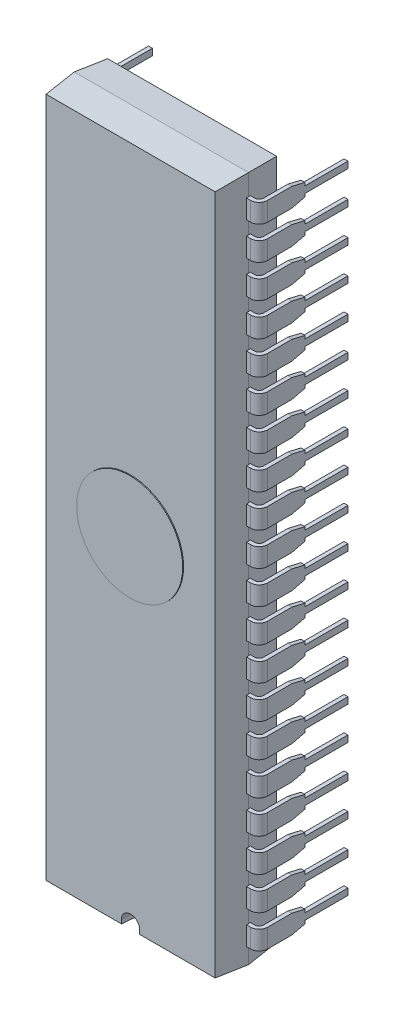
from build123d import *

# Parameters (mm, degrees)
BASIC_SHAPE_DEPTH               = 26.3
SIDE_PROFILE1_DEPTH             = 28.73140458
SIDE_PROFILE1_DEPTH_BACK        = 28.73140458
SIDE_PROFILE2_DEPTH             = 28.73140458
SIDE_PROFILE2_DEPTH_BACK        = 28.73140458
SKETCH6_W                       = 0.3
SKETCH6_H                       = 1.45
PIN_RELIEF_DEPTH                = 31.348853833
REMAINING_PINS_COUNT            = 20
REMAINING_PINS_PITCH            = 2.54
REMAINING_PINS_COPY_1_SKETCH_W  = 0.3
REMAINING_PINS_COPY_1_SKETCH_H  = 1.45
REMAINING_PINS_COPY_2_SKETCH_W  = 0.3
REMAINING_PINS_COPY_2_SKETCH_H  = 1.45
REMAINING_PINS_COPY_3_SKETCH_W  = 0.3
REMAINING_PINS_COPY_3_SKETCH_H  = 1.45
REMAINING_PINS_COPY_4_SKETCH_W  = 0.3
REMAINING_PINS_COPY_4_SKETCH_H  = 1.45
REMAINING_PINS_COPY_5_SKETCH_W  = 0.3
REMAINING_PINS_COPY_5_SKETCH_H  = 1.45
REMAINING_PINS_COPY_6_SKETCH_W  = 0.3
REMAINING_PINS_COPY_6_SKETCH_H  = 1.45
REMAINING_PINS_COPY_7_SKETCH_W  = 0.3
REMAINING_PINS_COPY_7_SKETCH_H  = 1.45
REMAINING_PINS_COPY_8_SKETCH_W  = 0.3
REMAINING_PINS_COPY_8_SKETCH_H  = 1.45
REMAINING_PINS_COPY_9_SKETCH_W  = 0.3
REMAINING_PINS_COPY_9_SKETCH_H  = 1.45
REMAINING_PINS_COPY_10_SKETCH_W = 0.3
REMAINING_PINS_COPY_10_SKETCH_H = 1.45
REMAINING_PINS_COPY_11_SKETCH_W = 0.3
REMAINING_PINS_COPY_11_SKETCH_H = 1.45
REMAINING_PINS_COPY_12_SKETCH_W = 0.3
REMAINING_PINS_COPY_12_SKETCH_H = 1.45
REMAINING_PINS_COPY_13_SKETCH_W = 0.3
REMAINING_PINS_COPY_13_SKETCH_H = 1.45
REMAINING_PINS_COPY_14_SKETCH_W = 0.3
REMAINING_PINS_COPY_14_SKETCH_H = 1.45
REMAINING_PINS_COPY_15_SKETCH_W = 0.3
REMAINING_PINS_COPY_15_SKETCH_H = 1.45
REMAINING_PINS_COPY_16_SKETCH_W = 0.3
REMAINING_PINS_COPY_16_SKETCH_H = 1.45
REMAINING_PINS_COPY_17_SKETCH_W = 0.3
REMAINING_PINS_COPY_17_SKETCH_H = 1.45
REMAINING_PINS_COPY_18_SKETCH_W = 0.3
REMAINING_PINS_COPY_18_SKETCH_H = 1.45
REMAINING_PINS_COPY_19_SKETCH_W = 0.3
REMAINING_PINS_COPY_19_SKETCH_H = 1.45
REMAINING_PINS_COPY_20_DEPTH    = 31.348853833
REMAINING_PINS_COPY_21_DEPTH    = 31.348853833
REMAINING_PINS_COPY_22_DEPTH    = 31.348853833
REMAINING_PINS_COPY_23_DEPTH    = 31.348853833
REMAINING_PINS_COPY_24_DEPTH    = 31.348853833
REMAINING_PINS_COPY_25_DEPTH    = 31.348853833
REMAINING_PINS_COPY_26_DEPTH    = 31.348853833
REMAINING_PINS_COPY_27_DEPTH    = 31.348853833
REMAINING_PINS_COPY_28_DEPTH    = 31.348853833
REMAINING_PINS_COPY_29_DEPTH    = 31.348853833
REMAINING_PINS_COPY_30_DEPTH    = 31.348853833
REMAINING_PINS_COPY_31_DEPTH    = 31.348853833
REMAINING_PINS_COPY_32_DEPTH    = 31.348853833
REMAINING_PINS_COPY_33_DEPTH    = 31.348853833
REMAINING_PINS_COPY_34_DEPTH    = 31.348853833
REMAINING_PINS_COPY_35_DEPTH    = 31.348853833
REMAINING_PINS_COPY_36_DEPTH    = 31.348853833
REMAINING_PINS_COPY_37_DEPTH    = 31.348853833
REMAINING_PINS_COPY_38_DEPTH    = 31.348853833
WINDOW_START                    = 5.72
WINDOW_OUTLINE_R                = 4.064
WINDOW_DEPTH                    = 0.07
LOCATION_MARK_DEPTH             = 29.83514954


# Read off the part's stored shape, not the designer's step: Window
with BuildPart() as part:
    # Sketch1 → Basic Shape (new, symmetric)
    with BuildSketch(Plane(origin=(0, 0, 0), x_dir=(1, 0, 0), z_dir=(0, 1, 0))):
        Polygon((-6.48, -5.72), (-6.68, -3.36), (-6.48, -1), (6.48, -1), (6.68, -3.36), (6.48, -5.72), align=None)
    extrude(amount=BASIC_SHAPE_DEPTH, both=True)

    # Sketch2 → Side Profile1 (cut, two sides: drawn at the far end of the back side and taken through both)
    with BuildSketch(Plane(origin=(0, 0, 0), x_dir=(0, 0, -1), z_dir=(1, 0, 0)).offset(-SIDE_PROFILE1_DEPTH_BACK)):
        Polygon((-1, 26.3), (-1, 26.1), (-3.36, 26.3), align=None)
        Polygon((-1, -26.3), (-3.36, -26.3), (-1, -26.1), align=None)
    extrude(amount=SIDE_PROFILE1_DEPTH + SIDE_PROFILE1_DEPTH_BACK, mode=Mode.SUBTRACT)

    # Sketch3 → Side Profile2 (cut, two sides: drawn at the far end of the back side and taken through both)
    with BuildSketch(Plane(origin=(0, 0, 0), x_dir=(0, 0, -1), z_dir=(1, 0, 0)).offset(-SIDE_PROFILE2_DEPTH_BACK)):
        Polygon((-3.36, 26.3), (-5.72, 26.3), (-5.72, 26.1), align=None)
        Polygon((-3.36, -26.3), (-5.72, -26.3), (-5.72, -26.1), align=None)
    extrude(amount=SIDE_PROFILE2_DEPTH + SIDE_PROFILE2_DEPTH_BACK, mode=Mode.SUBTRACT)

    # First Pin: sweep along a path in Sketch5
    with BuildLine(Plane(origin=(0, -24.3, 0), x_dir=(1, 0, 0), z_dir=(0, 1, 0))) as first_pin_path:
        Line((0, -3.36), (6.993, -3.36))
        ThreePointArc((6.993, -3.36), (7.346553391, -3.213553391), (7.493, -2.86))
        Line((7.493, -2.86), (7.493, 3.3))
    # Sketch6 → First Pin (sweep)
    with BuildSketch(Plane(origin=(0, 0, 0), x_dir=(0, 0, -1), z_dir=(1, 0, 0))):
        with Locations((-3.36, -24.3)):
            Rectangle(SKETCH6_W, SKETCH6_H)
    first_pin = sweep(path=first_pin_path.line)

    # Sketch7 → Pin Relief (cut, through all)
    with BuildSketch(Plane.ZY.offset(-7.343)):
        Polygon((-3.3, -24.55), (0, -24.55), (0, -24.7875), (1, -25.025), (-3.3, -25.025), align=None)
        Polygon((-3.3, -24.05), (0, -24.05), (0, -23.8125), (1, -23.575), (-3.3, -23.575), align=None)
    pin_relief = extrude(amount=-PIN_RELIEF_DEPTH, mode=Mode.SUBTRACT)

    # Opp Pin: First Pin, Pin Relief across plane
    add(first_pin.mirror(Plane(origin=(0, 0, 0), x_dir=(0, 0, 1), z_dir=(1, 0, 0))))
    add(pin_relief.mirror(Plane(origin=(0, 0, 0), x_dir=(0, 0, 1), z_dir=(1, 0, 0))), mode=Mode.SUBTRACT)

    # Remaining Pins: First Pin, Pin Relief ×20
    with Locations(*[(0, i * REMAINING_PINS_PITCH, 0) for i in range(1, REMAINING_PINS_COUNT)]):
        add(first_pin)
        add(pin_relief, mode=Mode.SUBTRACT)

    # Remaining Pins copy 1: sweep along a path in Remaining Pins copy 1 path
    with BuildLine(Plane(origin=(0, -21.76, 0), x_dir=(-1, 0, 0), z_dir=(0, 1, 0))) as remaining_pins_copy_1_path:
        Line((0, 3.36), (6.993, 3.36))
        ThreePointArc((6.993, 3.36), (7.346553391, 3.213553391), (7.493, 2.86))
        Line((7.493, 2.86), (7.493, -3.3))
    # Remaining Pins copy 1 sketch → Remaining Pins copy 1 (sweep)
    with BuildSketch(Plane(origin=(0, 2.54, 0), x_dir=(0, 0, -1), z_dir=(-1, 0, 0))):
        with Locations((-3.36, 24.3)):
            Rectangle(REMAINING_PINS_COPY_1_SKETCH_W, REMAINING_PINS_COPY_1_SKETCH_H)
    sweep(path=remaining_pins_copy_1_path.line)

    # Remaining Pins copy 2: sweep along a path in Remaining Pins copy 2 path
    with BuildLine(Plane(origin=(0, -19.22, 0), x_dir=(-1, 0, 0), z_dir=(0, 1, 0))) as remaining_pins_copy_2_path:
        Line((0, 3.36), (6.993, 3.36))
        ThreePointArc((6.993, 3.36), (7.346553391, 3.213553391), (7.493, 2.86))
        Line((7.493, 2.86), (7.493, -3.3))
    # Remaining Pins copy 2 sketch → Remaining Pins copy 2 (sweep)
    with BuildSketch(Plane(origin=(0, 5.08, 0), x_dir=(0, 0, -1), z_dir=(-1, 0, 0))):
        with Locations((-3.36, 24.3)):
            Rectangle(REMAINING_PINS_COPY_2_SKETCH_W, REMAINING_PINS_COPY_2_SKETCH_H)
    sweep(path=remaining_pins_copy_2_path.line)

    # Remaining Pins copy 3: sweep along a path in Remaining Pins copy 3 path
    with BuildLine(Plane(origin=(0, -16.68, 0), x_dir=(-1, 0, 0), z_dir=(0, 1, 0))) as remaining_pins_copy_3_path:
        Line((0, 3.36), (6.993, 3.36))
        ThreePointArc((6.993, 3.36), (7.346553391, 3.213553391), (7.493, 2.86))
        Line((7.493, 2.86), (7.493, -3.3))
    # Remaining Pins copy 3 sketch → Remaining Pins copy 3 (sweep)
    with BuildSketch(Plane(origin=(0, 7.62, 0), x_dir=(0, 0, -1), z_dir=(-1, 0, 0))):
        with Locations((-3.36, 24.3)):
            Rectangle(REMAINING_PINS_COPY_3_SKETCH_W, REMAINING_PINS_COPY_3_SKETCH_H)
    sweep(path=remaining_pins_copy_3_path.line)

    # Remaining Pins copy 4: sweep along a path in Remaining Pins copy 4 path
    with BuildLine(Plane(origin=(0, -14.14, 0), x_dir=(-1, 0, 0), z_dir=(0, 1, 0))) as remaining_pins_copy_4_path:
        Line((0, 3.36), (6.993, 3.36))
        ThreePointArc((6.993, 3.36), (7.346553391, 3.213553391), (7.493, 2.86))
        Line((7.493, 2.86), (7.493, -3.3))
    # Remaining Pins copy 4 sketch → Remaining Pins copy 4 (sweep)
    with BuildSketch(Plane(origin=(0, 10.16, 0), x_dir=(0, 0, -1), z_dir=(-1, 0, 0))):
        with Locations((-3.36, 24.3)):
            Rectangle(REMAINING_PINS_COPY_4_SKETCH_W, REMAINING_PINS_COPY_4_SKETCH_H)
    sweep(path=remaining_pins_copy_4_path.line)

    # Remaining Pins copy 5: sweep along a path in Remaining Pins copy 5 path
    with BuildLine(Plane(origin=(0, -11.6, 0), x_dir=(-1, 0, 0), z_dir=(0, 1, 0))) as remaining_pins_copy_5_path:
        Line((0, 3.36), (6.993, 3.36))
        ThreePointArc((6.993, 3.36), (7.346553391, 3.213553391), (7.493, 2.86))
        Line((7.493, 2.86), (7.493, -3.3))
    # Remaining Pins copy 5 sketch → Remaining Pins copy 5 (sweep)
    with BuildSketch(Plane(origin=(0, 12.7, 0), x_dir=(0, 0, -1), z_dir=(-1, 0, 0))):
        with Locations((-3.36, 24.3)):
            Rectangle(REMAINING_PINS_COPY_5_SKETCH_W, REMAINING_PINS_COPY_5_SKETCH_H)
    sweep(path=remaining_pins_copy_5_path.line)

    # Remaining Pins copy 6: sweep along a path in Remaining Pins copy 6 path
    with BuildLine(Plane(origin=(0, -9.06, 0), x_dir=(-1, 0, 0), z_dir=(0, 1, 0))) as remaining_pins_copy_6_path:
        Line((0, 3.36), (6.993, 3.36))
        ThreePointArc((6.993, 3.36), (7.346553391, 3.213553391), (7.493, 2.86))
        Line((7.493, 2.86), (7.493, -3.3))
    # Remaining Pins copy 6 sketch → Remaining Pins copy 6 (sweep)
    with BuildSketch(Plane(origin=(0, 15.24, 0), x_dir=(0, 0, -1), z_dir=(-1, 0, 0))):
        with Locations((-3.36, 24.3)):
            Rectangle(REMAINING_PINS_COPY_6_SKETCH_W, REMAINING_PINS_COPY_6_SKETCH_H)
    sweep(path=remaining_pins_copy_6_path.line)

    # Remaining Pins copy 7: sweep along a path in Remaining Pins copy 7 path
    with BuildLine(Plane(origin=(0, -6.52, 0), x_dir=(-1, 0, 0), z_dir=(0, 1, 0))) as remaining_pins_copy_7_path:
        Line((0, 3.36), (6.993, 3.36))
        ThreePointArc((6.993, 3.36), (7.346553391, 3.213553391), (7.493, 2.86))
        Line((7.493, 2.86), (7.493, -3.3))
    # Remaining Pins copy 7 sketch → Remaining Pins copy 7 (sweep)
    with BuildSketch(Plane(origin=(0, 17.78, 0), x_dir=(0, 0, -1), z_dir=(-1, 0, 0))):
        with Locations((-3.36, 24.3)):
            Rectangle(REMAINING_PINS_COPY_7_SKETCH_W, REMAINING_PINS_COPY_7_SKETCH_H)
    sweep(path=remaining_pins_copy_7_path.line)

    # Remaining Pins copy 8: sweep along a path in Remaining Pins copy 8 path
    with BuildLine(Plane(origin=(0, -3.98, 0), x_dir=(-1, 0, 0), z_dir=(0, 1, 0))) as remaining_pins_copy_8_path:
        Line((0, 3.36), (6.993, 3.36))
        ThreePointArc((6.993, 3.36), (7.346553391, 3.213553391), (7.493, 2.86))
        Line((7.493, 2.86), (7.493, -3.3))
    # Remaining Pins copy 8 sketch → Remaining Pins copy 8 (sweep)
    with BuildSketch(Plane(origin=(0, 20.32, 0), x_dir=(0, 0, -1), z_dir=(-1, 0, 0))):
        with Locations((-3.36, 24.3)):
            Rectangle(REMAINING_PINS_COPY_8_SKETCH_W, REMAINING_PINS_COPY_8_SKETCH_H)
    sweep(path=remaining_pins_copy_8_path.line)

    # Remaining Pins copy 9: sweep along a path in Remaining Pins copy 9 path
    with BuildLine(Plane(origin=(0, -1.44, 0), x_dir=(-1, 0, 0), z_dir=(0, 1, 0))) as remaining_pins_copy_9_path:
        Line((0, 3.36), (6.993, 3.36))
        ThreePointArc((6.993, 3.36), (7.346553391, 3.213553391), (7.493, 2.86))
        Line((7.493, 2.86), (7.493, -3.3))
    # Remaining Pins copy 9 sketch → Remaining Pins copy 9 (sweep)
    with BuildSketch(Plane(origin=(0, 22.86, 0), x_dir=(0, 0, -1), z_dir=(-1, 0, 0))):
        with Locations((-3.36, 24.3)):
            Rectangle(REMAINING_PINS_COPY_9_SKETCH_W, REMAINING_PINS_COPY_9_SKETCH_H)
    sweep(path=remaining_pins_copy_9_path.line)

    # Remaining Pins copy 10: sweep along a path in Remaining Pins copy 10 path
    with BuildLine(Plane(origin=(0, 1.1, 0), x_dir=(-1, 0, 0), z_dir=(0, 1, 0))) as remaining_pins_copy_10_path:
        Line((0, 3.36), (6.993, 3.36))
        ThreePointArc((6.993, 3.36), (7.346553391, 3.213553391), (7.493, 2.86))
        Line((7.493, 2.86), (7.493, -3.3))
    # Remaining Pins copy 10 sketch → Remaining Pins copy 10 (sweep)
    with BuildSketch(Plane(origin=(0, 25.4, 0), x_dir=(0, 0, -1), z_dir=(-1, 0, 0))):
        with Locations((-3.36, 24.3)):
            Rectangle(REMAINING_PINS_COPY_10_SKETCH_W, REMAINING_PINS_COPY_10_SKETCH_H)
    sweep(path=remaining_pins_copy_10_path.line)

    # Remaining Pins copy 11: sweep along a path in Remaining Pins copy 11 path
    with BuildLine(Plane(origin=(0, 3.64, 0), x_dir=(-1, 0, 0), z_dir=(0, 1, 0))) as remaining_pins_copy_11_path:
        Line((0, 3.36), (6.993, 3.36))
        ThreePointArc((6.993, 3.36), (7.346553391, 3.213553391), (7.493, 2.86))
        Line((7.493, 2.86), (7.493, -3.3))
    # Remaining Pins copy 11 sketch → Remaining Pins copy 11 (sweep)
    with BuildSketch(Plane(origin=(0, 27.94, 0), x_dir=(0, 0, -1), z_dir=(-1, 0, 0))):
        with Locations((-3.36, 24.3)):
            Rectangle(REMAINING_PINS_COPY_11_SKETCH_W, REMAINING_PINS_COPY_11_SKETCH_H)
    sweep(path=remaining_pins_copy_11_path.line)

    # Remaining Pins copy 12: sweep along a path in Remaining Pins copy 12 path
    with BuildLine(Plane(origin=(0, 6.18, 0), x_dir=(-1, 0, 0), z_dir=(0, 1, 0))) as remaining_pins_copy_12_path:
        Line((0, 3.36), (6.993, 3.36))
        ThreePointArc((6.993, 3.36), (7.346553391, 3.213553391), (7.493, 2.86))
        Line((7.493, 2.86), (7.493, -3.3))
    # Remaining Pins copy 12 sketch → Remaining Pins copy 12 (sweep)
    with BuildSketch(Plane(origin=(0, 30.48, 0), x_dir=(0, 0, -1), z_dir=(-1, 0, 0))):
        with Locations((-3.36, 24.3)):
            Rectangle(REMAINING_PINS_COPY_12_SKETCH_W, REMAINING_PINS_COPY_12_SKETCH_H)
    sweep(path=remaining_pins_copy_12_path.line)

    # Remaining Pins copy 13: sweep along a path in Remaining Pins copy 13 path
    with BuildLine(Plane(origin=(0, 8.72, 0), x_dir=(-1, 0, 0), z_dir=(0, 1, 0))) as remaining_pins_copy_13_path:
        Line((0, 3.36), (6.993, 3.36))
        ThreePointArc((6.993, 3.36), (7.346553391, 3.213553391), (7.493, 2.86))
        Line((7.493, 2.86), (7.493, -3.3))
    # Remaining Pins copy 13 sketch → Remaining Pins copy 13 (sweep)
    with BuildSketch(Plane(origin=(0, 33.02, 0), x_dir=(0, 0, -1), z_dir=(-1, 0, 0))):
        with Locations((-3.36, 24.3)):
            Rectangle(REMAINING_PINS_COPY_13_SKETCH_W, REMAINING_PINS_COPY_13_SKETCH_H)
    sweep(path=remaining_pins_copy_13_path.line)

    # Remaining Pins copy 14: sweep along a path in Remaining Pins copy 14 path
    with BuildLine(Plane(origin=(0, 11.26, 0), x_dir=(-1, 0, 0), z_dir=(0, 1, 0))) as remaining_pins_copy_14_path:
        Line((0, 3.36), (6.993, 3.36))
        ThreePointArc((6.993, 3.36), (7.346553391, 3.213553391), (7.493, 2.86))
        Line((7.493, 2.86), (7.493, -3.3))
    # Remaining Pins copy 14 sketch → Remaining Pins copy 14 (sweep)
    with BuildSketch(Plane(origin=(0, 35.56, 0), x_dir=(0, 0, -1), z_dir=(-1, 0, 0))):
        with Locations((-3.36, 24.3)):
            Rectangle(REMAINING_PINS_COPY_14_SKETCH_W, REMAINING_PINS_COPY_14_SKETCH_H)
    sweep(path=remaining_pins_copy_14_path.line)

    # Remaining Pins copy 15: sweep along a path in Remaining Pins copy 15 path
    with BuildLine(Plane(origin=(0, 13.8, 0), x_dir=(-1, 0, 0), z_dir=(0, 1, 0))) as remaining_pins_copy_15_path:
        Line((0, 3.36), (6.993, 3.36))
        ThreePointArc((6.993, 3.36), (7.346553391, 3.213553391), (7.493, 2.86))
        Line((7.493, 2.86), (7.493, -3.3))
    # Remaining Pins copy 15 sketch → Remaining Pins copy 15 (sweep)
    with BuildSketch(Plane(origin=(0, 38.1, 0), x_dir=(0, 0, -1), z_dir=(-1, 0, 0))):
        with Locations((-3.36, 24.3)):
            Rectangle(REMAINING_PINS_COPY_15_SKETCH_W, REMAINING_PINS_COPY_15_SKETCH_H)
    sweep(path=remaining_pins_copy_15_path.line)

    # Remaining Pins copy 16: sweep along a path in Remaining Pins copy 16 path
    with BuildLine(Plane(origin=(0, 16.34, 0), x_dir=(-1, 0, 0), z_dir=(0, 1, 0))) as remaining_pins_copy_16_path:
        Line((0, 3.36), (6.993, 3.36))
        ThreePointArc((6.993, 3.36), (7.346553391, 3.213553391), (7.493, 2.86))
        Line((7.493, 2.86), (7.493, -3.3))
    # Remaining Pins copy 16 sketch → Remaining Pins copy 16 (sweep)
    with BuildSketch(Plane(origin=(0, 40.64, 0), x_dir=(0, 0, -1), z_dir=(-1, 0, 0))):
        with Locations((-3.36, 24.3)):
            Rectangle(REMAINING_PINS_COPY_16_SKETCH_W, REMAINING_PINS_COPY_16_SKETCH_H)
    sweep(path=remaining_pins_copy_16_path.line)

    # Remaining Pins copy 17: sweep along a path in Remaining Pins copy 17 path
    with BuildLine(Plane(origin=(0, 18.88, 0), x_dir=(-1, 0, 0), z_dir=(0, 1, 0))) as remaining_pins_copy_17_path:
        Line((0, 3.36), (6.993, 3.36))
        ThreePointArc((6.993, 3.36), (7.346553391, 3.213553391), (7.493, 2.86))
        Line((7.493, 2.86), (7.493, -3.3))
    # Remaining Pins copy 17 sketch → Remaining Pins copy 17 (sweep)
    with BuildSketch(Plane(origin=(0, 43.18, 0), x_dir=(0, 0, -1), z_dir=(-1, 0, 0))):
        with Locations((-3.36, 24.3)):
            Rectangle(REMAINING_PINS_COPY_17_SKETCH_W, REMAINING_PINS_COPY_17_SKETCH_H)
    sweep(path=remaining_pins_copy_17_path.line)

    # Remaining Pins copy 18: sweep along a path in Remaining Pins copy 18 path
    with BuildLine(Plane(origin=(0, 21.42, 0), x_dir=(-1, 0, 0), z_dir=(0, 1, 0))) as remaining_pins_copy_18_path:
        Line((0, 3.36), (6.993, 3.36))
        ThreePointArc((6.993, 3.36), (7.346553391, 3.213553391), (7.493, 2.86))
        Line((7.493, 2.86), (7.493, -3.3))
    # Remaining Pins copy 18 sketch → Remaining Pins copy 18 (sweep)
    with BuildSketch(Plane(origin=(0, 45.72, 0), x_dir=(0, 0, -1), z_dir=(-1, 0, 0))):
        with Locations((-3.36, 24.3)):
            Rectangle(REMAINING_PINS_COPY_18_SKETCH_W, REMAINING_PINS_COPY_18_SKETCH_H)
    sweep(path=remaining_pins_copy_18_path.line)

    # Remaining Pins copy 19: sweep along a path in Remaining Pins copy 19 path
    with BuildLine(Plane(origin=(0, 23.96, 0), x_dir=(-1, 0, 0), z_dir=(0, 1, 0))) as remaining_pins_copy_19_path:
        Line((0, 3.36), (6.993, 3.36))
        ThreePointArc((6.993, 3.36), (7.346553391, 3.213553391), (7.493, 2.86))
        Line((7.493, 2.86), (7.493, -3.3))
    # Remaining Pins copy 19 sketch → Remaining Pins copy 19 (sweep)
    with BuildSketch(Plane(origin=(0, 48.26, 0), x_dir=(0, 0, -1), z_dir=(-1, 0, 0))):
        with Locations((-3.36, 24.3)):
            Rectangle(REMAINING_PINS_COPY_19_SKETCH_W, REMAINING_PINS_COPY_19_SKETCH_H)
    sweep(path=remaining_pins_copy_19_path.line)

    # Remaining Pins copy 20 sketch → Remaining Pins copy 20 (cut, through all)
    with BuildSketch(Plane(origin=(-7.343, 2.54, 0), x_dir=(0, 0, 1), z_dir=(1, 0, 0))):
        Polygon((-3.3, 24.55), (0, 24.55), (0, 24.7875), (1, 25.025), (-3.3, 25.025), align=None)
        Polygon((-3.3, 24.05), (0, 24.05), (0, 23.8125), (1, 23.575), (-3.3, 23.575), align=None)
    extrude(amount=-REMAINING_PINS_COPY_20_DEPTH, mode=Mode.SUBTRACT)

    # Remaining Pins copy 21 sketch → Remaining Pins copy 21 (cut, through all)
    with BuildSketch(Plane(origin=(-7.343, 5.08, 0), x_dir=(0, 0, 1), z_dir=(1, 0, 0))):
        Polygon((-3.3, 24.55), (0, 24.55), (0, 24.7875), (1, 25.025), (-3.3, 25.025), align=None)
        Polygon((-3.3, 24.05), (0, 24.05), (0, 23.8125), (1, 23.575), (-3.3, 23.575), align=None)
    extrude(amount=-REMAINING_PINS_COPY_21_DEPTH, mode=Mode.SUBTRACT)

    # Remaining Pins copy 22 sketch → Remaining Pins copy 22 (cut, through all)
    with BuildSketch(Plane(origin=(-7.343, 7.62, 0), x_dir=(0, 0, 1), z_dir=(1, 0, 0))):
        Polygon((-3.3, 24.55), (0, 24.55), (0, 24.7875), (1, 25.025), (-3.3, 25.025), align=None)
        Polygon((-3.3, 24.05), (0, 24.05), (0, 23.8125), (1, 23.575), (-3.3, 23.575), align=None)
    extrude(amount=-REMAINING_PINS_COPY_22_DEPTH, mode=Mode.SUBTRACT)

    # Remaining Pins copy 23 sketch → Remaining Pins copy 23 (cut, through all)
    with BuildSketch(Plane(origin=(-7.343, 10.16, 0), x_dir=(0, 0, 1), z_dir=(1, 0, 0))):
        Polygon((-3.3, 24.55), (0, 24.55), (0, 24.7875), (1, 25.025), (-3.3, 25.025), align=None)
        Polygon((-3.3, 24.05), (0, 24.05), (0, 23.8125), (1, 23.575), (-3.3, 23.575), align=None)
    extrude(amount=-REMAINING_PINS_COPY_23_DEPTH, mode=Mode.SUBTRACT)

    # Remaining Pins copy 24 sketch → Remaining Pins copy 24 (cut, through all)
    with BuildSketch(Plane(origin=(-7.343, 12.7, 0), x_dir=(0, 0, 1), z_dir=(1, 0, 0))):
        Polygon((-3.3, 24.55), (0, 24.55), (0, 24.7875), (1, 25.025), (-3.3, 25.025), align=None)
        Polygon((-3.3, 24.05), (0, 24.05), (0, 23.8125), (1, 23.575), (-3.3, 23.575), align=None)
    extrude(amount=-REMAINING_PINS_COPY_24_DEPTH, mode=Mode.SUBTRACT)

    # Remaining Pins copy 25 sketch → Remaining Pins copy 25 (cut, through all)
    with BuildSketch(Plane(origin=(-7.343, 15.24, 0), x_dir=(0, 0, 1), z_dir=(1, 0, 0))):
        Polygon((-3.3, 24.55), (0, 24.55), (0, 24.7875), (1, 25.025), (-3.3, 25.025), align=None)
        Polygon((-3.3, 24.05), (0, 24.05), (0, 23.8125), (1, 23.575), (-3.3, 23.575), align=None)
    extrude(amount=-REMAINING_PINS_COPY_25_DEPTH, mode=Mode.SUBTRACT)

    # Remaining Pins copy 26 sketch → Remaining Pins copy 26 (cut, through all)
    with BuildSketch(Plane(origin=(-7.343, 17.78, 0), x_dir=(0, 0, 1), z_dir=(1, 0, 0))):
        Polygon((-3.3, 24.55), (0, 24.55), (0, 24.7875), (1, 25.025), (-3.3, 25.025), align=None)
        Polygon((-3.3, 24.05), (0, 24.05), (0, 23.8125), (1, 23.575), (-3.3, 23.575), align=None)
    extrude(amount=-REMAINING_PINS_COPY_26_DEPTH, mode=Mode.SUBTRACT)

    # Remaining Pins copy 27 sketch → Remaining Pins copy 27 (cut, through all)
    with BuildSketch(Plane(origin=(-7.343, 20.32, 0), x_dir=(0, 0, 1), z_dir=(1, 0, 0))):
        Polygon((-3.3, 24.55), (0, 24.55), (0, 24.7875), (1, 25.025), (-3.3, 25.025), align=None)
        Polygon((-3.3, 24.05), (0, 24.05), (0, 23.8125), (1, 23.575), (-3.3, 23.575), align=None)
    extrude(amount=-REMAINING_PINS_COPY_27_DEPTH, mode=Mode.SUBTRACT)

    # Remaining Pins copy 28 sketch → Remaining Pins copy 28 (cut, through all)
    with BuildSketch(Plane(origin=(-7.343, 22.86, 0), x_dir=(0, 0, 1), z_dir=(1, 0, 0))):
        Polygon((-3.3, 24.55), (0, 24.55), (0, 24.7875), (1, 25.025), (-3.3, 25.025), align=None)
        Polygon((-3.3, 24.05), (0, 24.05), (0, 23.8125), (1, 23.575), (-3.3, 23.575), align=None)
    extrude(amount=-REMAINING_PINS_COPY_28_DEPTH, mode=Mode.SUBTRACT)

    # Remaining Pins copy 29 sketch → Remaining Pins copy 29 (cut, through all)
    with BuildSketch(Plane(origin=(-7.343, 25.4, 0), x_dir=(0, 0, 1), z_dir=(1, 0, 0))):
        Polygon((-3.3, 24.55), (0, 24.55), (0, 24.7875), (1, 25.025), (-3.3, 25.025), align=None)
        Polygon((-3.3, 24.05), (0, 24.05), (0, 23.8125), (1, 23.575), (-3.3, 23.575), align=None)
    extrude(amount=-REMAINING_PINS_COPY_29_DEPTH, mode=Mode.SUBTRACT)

    # Remaining Pins copy 30 sketch → Remaining Pins copy 30 (cut, through all)
    with BuildSketch(Plane(origin=(-7.343, 27.94, 0), x_dir=(0, 0, 1), z_dir=(1, 0, 0))):
        Polygon((-3.3, 24.55), (0, 24.55), (0, 24.7875), (1, 25.025), (-3.3, 25.025), align=None)
        Polygon((-3.3, 24.05), (0, 24.05), (0, 23.8125), (1, 23.575), (-3.3, 23.575), align=None)
    extrude(amount=-REMAINING_PINS_COPY_30_DEPTH, mode=Mode.SUBTRACT)

    # Remaining Pins copy 31 sketch → Remaining Pins copy 31 (cut, through all)
    with BuildSketch(Plane(origin=(-7.343, 30.48, 0), x_dir=(0, 0, 1), z_dir=(1, 0, 0))):
        Polygon((-3.3, 24.55), (0, 24.55), (0, 24.7875), (1, 25.025), (-3.3, 25.025), align=None)
        Polygon((-3.3, 24.05), (0, 24.05), (0, 23.8125), (1, 23.575), (-3.3, 23.575), align=None)
    extrude(amount=-REMAINING_PINS_COPY_31_DEPTH, mode=Mode.SUBTRACT)

    # Remaining Pins copy 32 sketch → Remaining Pins copy 32 (cut, through all)
    with BuildSketch(Plane(origin=(-7.343, 33.02, 0), x_dir=(0, 0, 1), z_dir=(1, 0, 0))):
        Polygon((-3.3, 24.55), (0, 24.55), (0, 24.7875), (1, 25.025), (-3.3, 25.025), align=None)
        Polygon((-3.3, 24.05), (0, 24.05), (0, 23.8125), (1, 23.575), (-3.3, 23.575), align=None)
    extrude(amount=-REMAINING_PINS_COPY_32_DEPTH, mode=Mode.SUBTRACT)

    # Remaining Pins copy 33 sketch → Remaining Pins copy 33 (cut, through all)
    with BuildSketch(Plane(origin=(-7.343, 35.56, 0), x_dir=(0, 0, 1), z_dir=(1, 0, 0))):
        Polygon((-3.3, 24.55), (0, 24.55), (0, 24.7875), (1, 25.025), (-3.3, 25.025), align=None)
        Polygon((-3.3, 24.05), (0, 24.05), (0, 23.8125), (1, 23.575), (-3.3, 23.575), align=None)
    extrude(amount=-REMAINING_PINS_COPY_33_DEPTH, mode=Mode.SUBTRACT)

    # Remaining Pins copy 34 sketch → Remaining Pins copy 34 (cut, through all)
    with BuildSketch(Plane(origin=(-7.343, 38.1, 0), x_dir=(0, 0, 1), z_dir=(1, 0, 0))):
        Polygon((-3.3, 24.55), (0, 24.55), (0, 24.7875), (1, 25.025), (-3.3, 25.025), align=None)
        Polygon((-3.3, 24.05), (0, 24.05), (0, 23.8125), (1, 23.575), (-3.3, 23.575), align=None)
    extrude(amount=-REMAINING_PINS_COPY_34_DEPTH, mode=Mode.SUBTRACT)

    # Remaining Pins copy 35 sketch → Remaining Pins copy 35 (cut, through all)
    with BuildSketch(Plane(origin=(-7.343, 40.64, 0), x_dir=(0, 0, 1), z_dir=(1, 0, 0))):
        Polygon((-3.3, 24.55), (0, 24.55), (0, 24.7875), (1, 25.025), (-3.3, 25.025), align=None)
        Polygon((-3.3, 24.05), (0, 24.05), (0, 23.8125), (1, 23.575), (-3.3, 23.575), align=None)
    extrude(amount=-REMAINING_PINS_COPY_35_DEPTH, mode=Mode.SUBTRACT)

    # Remaining Pins copy 36 sketch → Remaining Pins copy 36 (cut, through all)
    with BuildSketch(Plane(origin=(-7.343, 43.18, 0), x_dir=(0, 0, 1), z_dir=(1, 0, 0))):
        Polygon((-3.3, 24.55), (0, 24.55), (0, 24.7875), (1, 25.025), (-3.3, 25.025), align=None)
        Polygon((-3.3, 24.05), (0, 24.05), (0, 23.8125), (1, 23.575), (-3.3, 23.575), align=None)
    extrude(amount=-REMAINING_PINS_COPY_36_DEPTH, mode=Mode.SUBTRACT)

    # Remaining Pins copy 37 sketch → Remaining Pins copy 37 (cut, through all)
    with BuildSketch(Plane(origin=(-7.343, 45.72, 0), x_dir=(0, 0, 1), z_dir=(1, 0, 0))):
        Polygon((-3.3, 24.55), (0, 24.55), (0, 24.7875), (1, 25.025), (-3.3, 25.025), align=None)
        Polygon((-3.3, 24.05), (0, 24.05), (0, 23.8125), (1, 23.575), (-3.3, 23.575), align=None)
    extrude(amount=-REMAINING_PINS_COPY_37_DEPTH, mode=Mode.SUBTRACT)

    # Remaining Pins copy 38 sketch → Remaining Pins copy 38 (cut, through all)
    with BuildSketch(Plane(origin=(-7.343, 48.26, 0), x_dir=(0, 0, 1), z_dir=(1, 0, 0))):
        Polygon((-3.3, 24.55), (0, 24.55), (0, 24.7875), (1, 25.025), (-3.3, 25.025), align=None)
        Polygon((-3.3, 24.05), (0, 24.05), (0, 23.8125), (1, 23.575), (-3.3, 23.575), align=None)
    extrude(amount=-REMAINING_PINS_COPY_38_DEPTH, mode=Mode.SUBTRACT)

    # Window outline → Window (add)
    with BuildSketch(Plane.XY.offset(WINDOW_START)):
        Circle(WINDOW_OUTLINE_R)
    extrude(amount=WINDOW_DEPTH)

    # Sketch4 → Location Mark (cut, through all)
    with BuildSketch(Plane.XY.offset(5.72)):
        with BuildLine():
            Line((-0.7, -26.3), (-0.7, -25.8))
            ThreePointArc((-0.7, -25.8), (0, -25.1), (0.7, -25.8))
            Line((0.7, -25.8), (0.7, -26.3))
            Line((0.7, -26.3), (-0.7, -26.3))
        make_face()
    extrude(amount=-LOCATION_MARK_DEPTH, mode=Mode.SUBTRACT)


solid = part.part
